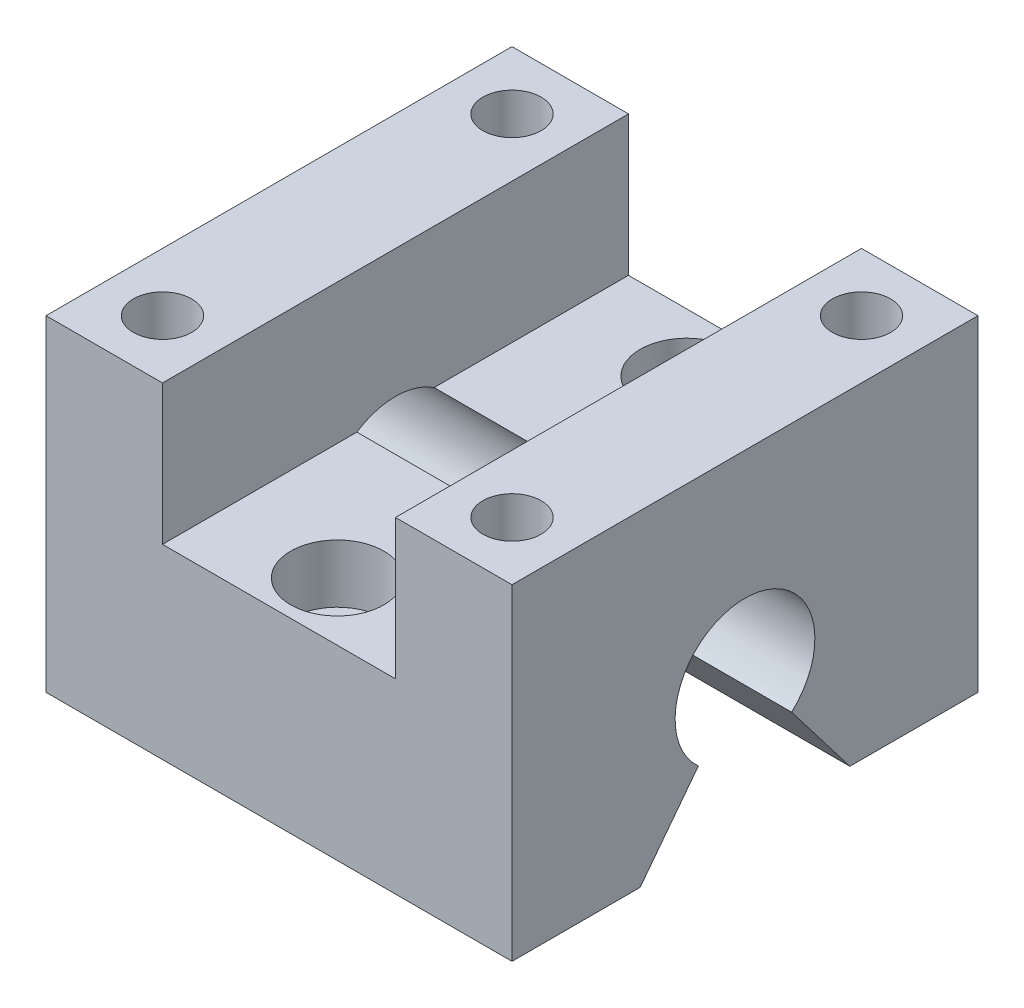
from build123d import *

# Parameters (mm, degrees)
EXTRUDE_1_DEPTH          = 20
CUT_EXTRUDE_1_DEPTH      = 32.559467676
CUT_EXTRUDE_1_DEPTH_BACK = 32.559467676
SKETCH_2_W               = 20
SKETCH_2_H               = 19.616393828
SKETCH_3_R               = 4
CUT_EXTRUDE_2_DEPTH      = 5
SKETCH_4_R               = 2.5
CUT_EXTRUDE_3_DEPTH      = 10


with BuildPart() as part:
    # Эскиз1 → Бобышка-Вытянуть1 (new, symmetric)
    with BuildSketch(Plane(origin=(0, 0, 0), x_dir=(0, 0, -1), z_dir=(1, 0, 0))):
        with BuildLine():
            Line((-4, -7.472135955), (-9, -14))
            Line((-9, -14), (-20, -14))
            Line((-20, -14), (-20, 14))
            Line((-20, 14), (20, 14))
            Line((20, 14), (20, -14))
            Line((20, -14), (9, -14))
            Line((9, -14), (4, -7.472135955))
            ThreePointArc((4, -7.472135955), (0, 3), (-4, -7.472135955))
        make_face()
    extrude(amount=EXTRUDE_1_DEPTH, both=True)

    # Эскиз2 → Вырез-Вытянуть1 (cut, two sides: drawn at the far end of the back side and taken through both)
    with BuildSketch(Plane.XY.offset(-CUT_EXTRUDE_1_DEPTH_BACK)):
        with Locations((0, 11.808196914)):
            Rectangle(SKETCH_2_W, SKETCH_2_H)
    extrude(amount=CUT_EXTRUDE_1_DEPTH + CUT_EXTRUDE_1_DEPTH_BACK, mode=Mode.SUBTRACT)

    # Эскиз3 → Вырез-Вытянуть2 (cut)
    with BuildSketch(Plane(origin=(0, 2, 0), x_dir=(1, 0, 0), z_dir=(0, 1, 0))):
        with Locations((0, 15)):
            Circle(SKETCH_3_R)
        with Locations((0, -15)):
            Circle(SKETCH_3_R)
    extrude(amount=-CUT_EXTRUDE_2_DEPTH, mode=Mode.SUBTRACT)

    # Эскиз4 → Вырез-Вытянуть3 (cut)
    with BuildSketch(Plane(origin=(0, 14, 0), x_dir=(1, 0, 0), z_dir=(0, 1, 0))):
        with Locations((-15, 15)):
            Circle(SKETCH_4_R)
        with Locations((-15, -15)):
            Circle(SKETCH_4_R)
        with Locations((15, -15)):
            Circle(SKETCH_4_R)
        with Locations((15, 15)):
            Circle(SKETCH_4_R)
    extrude(amount=-CUT_EXTRUDE_3_DEPTH, mode=Mode.SUBTRACT)


solid = part.part
